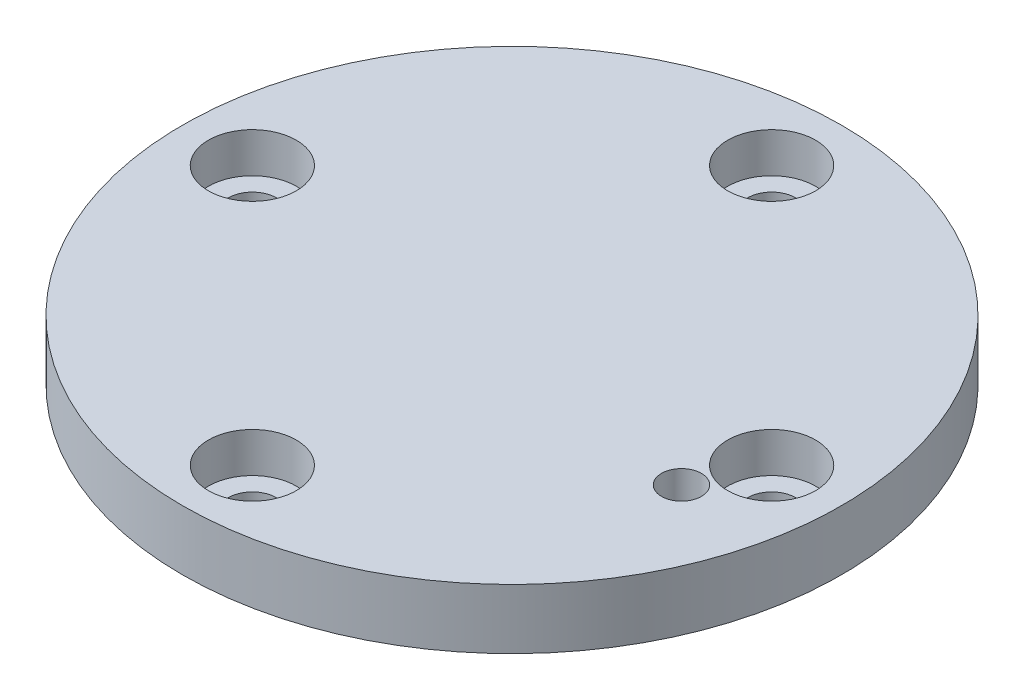
from build123d import *

# Parameters (mm, degrees)
SKETCH1_R                      = 16.5
BOSS_EXTRUDE1_DEPTH            = 3
CBORE_FOR_M2_SHCS1_D           = 2.4
CBORE_FOR_M2_SHCS1_CBORE_D     = 4.4
CBORE_FOR_M2_SHCS1_CBORE_DEPTH = 2
CIRPATTERN1_COUNT              = 4
SKETCH8_R                      = 0.5
CUT_EXTRUDE1_DEPTH             = 1.5
SKETCH9_R                      = 1
CUT_EXTRUDE2_DEPTH             = 10


with BuildPart() as part:
    # Sketch1 → Boss-Extrude1 (new body)
    with BuildSketch(Plane(origin=(0, 0, 0), x_dir=(1, 0, 0), z_dir=(0, 1, 0))):
        Circle(SKETCH1_R)
    extrude(amount=BOSS_EXTRUDE1_DEPTH)

    # CBORE for M2 SHCS1 (through all)
    with Locations(Plane(origin=(0, 3, 0), x_dir=(1, 0, 0), z_dir=(0, 1, 0))):
        with Locations((13, 0)):
            cbore_for_m2_shcs1 = CounterBoreHole(CBORE_FOR_M2_SHCS1_D / 2, CBORE_FOR_M2_SHCS1_CBORE_D / 2, CBORE_FOR_M2_SHCS1_CBORE_DEPTH)

    # CirPattern1: CBORE for M2 SHCS1 ×4 about axis
    cirpattern1_axis = Axis((0, 3, 0), (0, 1, 0))
    for i in range(1, CIRPATTERN1_COUNT):
        add(cbore_for_m2_shcs1.rotate(cirpattern1_axis, i * 360 / CIRPATTERN1_COUNT), mode=Mode.SUBTRACT)

    # Sketch8 → Cut-Extrude1 (cut)
    with BuildSketch(Plane.XZ):
        with Locations((6, 0)):
            Circle(SKETCH8_R)
    extrude(amount=-CUT_EXTRUDE1_DEPTH, mode=Mode.SUBTRACT)

    # Sketch9 → Cut-Extrude2 (cut)
    with BuildSketch(Plane(origin=(0, 3, 0), x_dir=(1, 0, 0), z_dir=(0, 1, 0))):
        with Locations((11.591109915, -3.105828541)):
            Circle(SKETCH9_R)
    extrude(amount=-CUT_EXTRUDE2_DEPTH, mode=Mode.SUBTRACT)


solid = part.part
